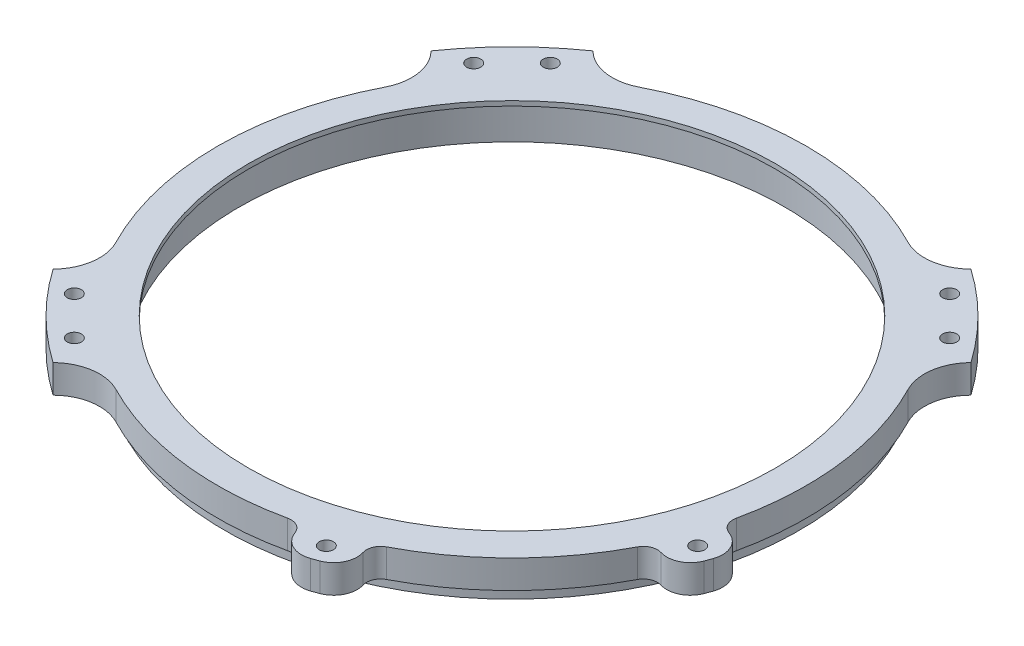
from build123d import *

# Parameters (mm, degrees)
SKETCH_1_R          = 70
SKETCH_1_R_2        = 58
EXTRUDE_1_DEPTH     = 9
SKETCH_3_R          = 70
SKETCH_3_R_2        = 61
CUT_EXTRUDE_2_DEPTH = 3
CUT_EXTRUDE_3_DEPTH = 100.403219264
FILLET_1_R          = 10
CUT_EXTRUDE_6_DEPTH = 97.044388064
FILLET_7_R          = 3
SKETCH_6_R          = 1.5
CUT_EXTRUDE_4_DEPTH = 10
FILLET_9_R          = 5
EXTRUDE_START       = -1
SKETCH_9_R          = 58
SKETCH_9_R_2        = 56
EXTRUDE_2_DEPTH     = 1


with BuildPart() as part:
    # 草图1 → 凸台-拉伸1 (new body)
    with BuildSketch(Plane(origin=(0, 0, 0), x_dir=(1, 0, 0), z_dir=(0, 1, 0))):
        with Locations(Location((0, 0, 0), (0, 0, 270))):
            Circle(SKETCH_1_R)
        with Locations(Location((0, 0, 0), (0, 0, 270))):
            Circle(SKETCH_1_R_2, mode=Mode.SUBTRACT)
    extrude(amount=EXTRUDE_1_DEPTH)

    # 草图3 → 切除-拉伸2 (cut)
    with BuildSketch(Plane.XZ):
        with Locations(Location((0, 0, 0), (0, 0, 270))):
            Circle(SKETCH_3_R)
        with Locations(Location((0, 0, 0), (0, 0, 270))):
            Circle(SKETCH_3_R_2, mode=Mode.SUBTRACT)
    extrude(amount=-CUT_EXTRUDE_2_DEPTH, mode=Mode.SUBTRACT)

    # 草图4 → 切除-拉伸3 (cut, through all)
    with BuildSketch(Plane(origin=(0, 9, 0), x_dir=(1, 0, 0), z_dir=(0, 1, 0))):
        with BuildLine():
            Line((35.848527272, 51.197002768), (40.150350545, 57.3406431))
            ThreePointArc((40.150350545, 57.3406431), (0, 70), (-40.150350545, 57.3406431))
            Line((-40.150350545, 57.3406431), (-35.848527272, 51.197002768))
            ThreePointArc((-35.848527272, 51.197002768), (0, 62.5), (35.848527272, 51.197002768))
        make_face()
        with BuildLine():
            Line((51.197002768, 35.848527272), (57.3406431, 40.150350545))
            ThreePointArc((57.3406431, 40.150350545), (68.936542711, 12.155372437), (67.61480784, -18.117333157))
            Line((67.61480784, -18.117333157), (60.370364143, -16.176190319))
            ThreePointArc((60.370364143, -16.176190319), (61.550484563, 10.853011104), (51.197002768, 35.848527272))
        make_face()
        with BuildLine():
            Line((16.176190319, -60.370364143), (18.117333157, -67.61480784))
            ThreePointArc((18.117333157, -67.61480784), (-12.155372437, -68.936542711), (-40.150350545, -57.3406431))
            Line((-40.150350545, -57.3406431), (-35.848527272, -51.197002768))
            ThreePointArc((-35.848527272, -51.197002768), (-10.853011104, -61.550484563), (16.176190319, -60.370364143))
        make_face()
        with BuildLine():
            Line((-51.197002768, -35.848527272), (-57.3406431, -40.150350545))
            ThreePointArc((-57.3406431, -40.150350545), (-70, 0), (-57.3406431, 40.150350545))
            Line((-57.3406431, 40.150350545), (-51.197002768, 35.848527272))
            ThreePointArc((-51.197002768, 35.848527272), (-62.5, 0), (-51.197002768, -35.848527272))
        make_face()
    extrude(amount=-CUT_EXTRUDE_3_DEPTH, mode=Mode.SUBTRACT)

    # 圆角1
    # the kernel refuses this fillet: 10 mm, written as the material it adds along each edge
    with BuildSketch(Plane(origin=(-51.197002768, 9, 35.848527272), x_dir=(-0.8191520442890221, 0, 0.5735764363510029), z_dir=(0, -1, 0)), Plane(origin=(51.197002768, 9, -35.848527272), x_dir=(0.8191520442890228, 0, -0.5735764363510018), z_dir=(0, -1, 0)), Plane(origin=(-35.848527272, 9, -51.197002768), x_dir=(-0.5735764363510008, 0, -0.8191520442890236), z_dir=(0, -1, 0))) as fillet_1_piece_1:
        with BuildLine():
            CenterArc((9.330357143, 9.831062645), FILLET_1_R, 187.793366371, 71.660001872)
            Line((-0.577278325, 8.475054004), (-0.775431034, 8.447933831))
            ThreePointArc((-0.775431034, 8.447933831), (-0.344024235, 4.233754448), (-0.2, 0))
            Line((-0.2, 0), (0, -0.2))
            ThreePointArc((0, -0.2), (3.75, -0.2), (7.463392857, -0.196621253))
            Line((7.463392857, -0.196621253), (7.5, 0))
        make_face()
    extrude(amount=6)
    with BuildSketch(Plane(origin=(-35.848527272, 9, 51.197002768), x_dir=(-0.5735764363510476, 0, 0.8191520442889907), z_dir=(0, -1, 0))) as fillet_1_piece_2:
        with BuildLine():
            CenterArc((9.330357143, -9.831062645), FILLET_1_R, 100.546631757, 71.660001872)
            Line((-0.577278325, -8.475054004), (-0.775431034, -8.447933831))
            ThreePointArc((-0.775431034, -8.447933831), (-0.344024235, -4.233754448), (-0.2, 0))
            Line((-0.2, 0), (0, 0.2))
            ThreePointArc((0, 0.2), (3.75, 0.2), (7.463392857, 0.196621253))
            Line((7.463392857, 0.196621253), (7.5, 0))
        make_face()
    extrude(amount=6)
    with BuildSketch(Plane(origin=(35.848527272, 9, -51.197002768), x_dir=(-0.8562371813975653, 0, -0.5165828967284464), z_dir=(0, -1, 0)), Plane(origin=(-51.197002768, 9, -35.848527272), x_dir=(-0.5165828967284464, 0, 0.8562371813975653), z_dir=(0, -1, 0))) as fillet_1_piece_3:
        with BuildLine():
            CenterArc((9.174267262, 9.976882145), FILLET_1_R, 194.443314943, 71.660001872)
            Line((-0.509681515, 7.482661609), (-0.70336049, 7.432777198))
            ThreePointArc((-0.70336049, 7.432777198), (-0.4543784, 3.727739297), (-0.199537643, -0.013591507))
            Line((-0.199537643, -0.013591507), (0.013591507, -0.199537643))
            ThreePointArc((0.013591507, -0.199537643), (4.247345955, -0.055513408), (8.481100403, -0.199537643))
            Line((8.481100403, -0.199537643), (8.49469191, 0))
        make_face()
    extrude(amount=6)

    # 草图8 → 切除-拉伸6 (cut, through all)
    with BuildSketch(Plane(origin=(0, 9, 0), x_dir=(1, 0, 0), z_dir=(0, 1, 0))):
        with BuildLine():
            Line((26.62495049, -57.097390583), (29.583278322, -63.441545093))
            ThreePointArc((29.583278322, -63.441545093), (49.497474683, -49.497474683), (63.441545093, -29.583278322))
            Line((63.441545093, -29.583278322), (57.097390583, -26.62495049))
            ThreePointArc((57.097390583, -26.62495049), (44.547727215, -44.547727215), (26.62495049, -57.097390583))
        make_face()
    extrude(amount=-CUT_EXTRUDE_6_DEPTH, mode=Mode.SUBTRACT)

    # 圆角7
    fillet_7_edges = [part.edges().sort_by_distance(p)[0] for p in [
        (26.62495049, 6, 57.097390583),
        (57.097390583, 6, 26.62495049),
        (60.370364143, 6, 16.176190319),
        (16.176190319, 6, 60.370364143),
    ]]
    fillet(fillet_7_edges, radius=FILLET_7_R)

    # 草图6 → 切除-拉伸4 (cut)
    with BuildSketch(Plane(origin=(0, 9, 0), x_dir=(1, 0, 0), z_dir=(0, 1, 0))):
        with Locations(Location((42.423982239, 50.558933246, 0), (0, 0, 270))):
            Circle(SKETCH_6_R)
        with Locations(Location((-42.423982239, -50.558933246, 0), (0, 0, 270))):
            Circle(SKETCH_6_R)
        with Locations(Location((-50.558933246, 42.423982239, 0), (0, 0, 270))):
            Circle(SKETCH_6_R)
        with Locations(Location((50.558933246, 42.423982239, 0), (0, 0, 90))):
            Circle(SKETCH_6_R)
        with Locations(Location((-50.558933246, -42.423982239, 0), (0, 0, 90))):
            Circle(SKETCH_6_R)
        with Locations(Location((-42.423982239, 50.558933246, 0), (0, 0, 90))):
            Circle(SKETCH_6_R)
        with Locations(Location((22.573329459, -62.019712972, 0), (0, 0, 270))):
            Circle(SKETCH_6_R)
        with Locations(Location((62.019712972, -22.573329459, 0), (0, 0, 90))):
            Circle(SKETCH_6_R)
    extrude(amount=-CUT_EXTRUDE_4_DEPTH, mode=Mode.SUBTRACT)

    # 圆角9
    fillet_9_edges = [part.edges().sort_by_distance(p)[0] for p in [
        (67.61480784, 6, 18.117333157),
        (63.441545093, 6, 29.583278322),
        (18.117333157, 6, 67.61480784),
        (29.583278322, 6, 63.441545093),
    ]]
    fillet(fillet_9_edges, radius=FILLET_9_R)

    # 草图9 → 凸台-拉伸2 (add)
    with BuildSketch(Plane(origin=(0, 9, 0), x_dir=(1, 0, 0), z_dir=(0, 1, 0)).offset(EXTRUDE_START)):
        with Locations(Location((0, 0, 0), (0, 0, 270))):
            Circle(SKETCH_9_R)
        with Locations(Location((0, 0, 0), (0, 0, 270))):
            Circle(SKETCH_9_R_2, mode=Mode.SUBTRACT)
    extrude(amount=EXTRUDE_2_DEPTH)


solid = part.part
